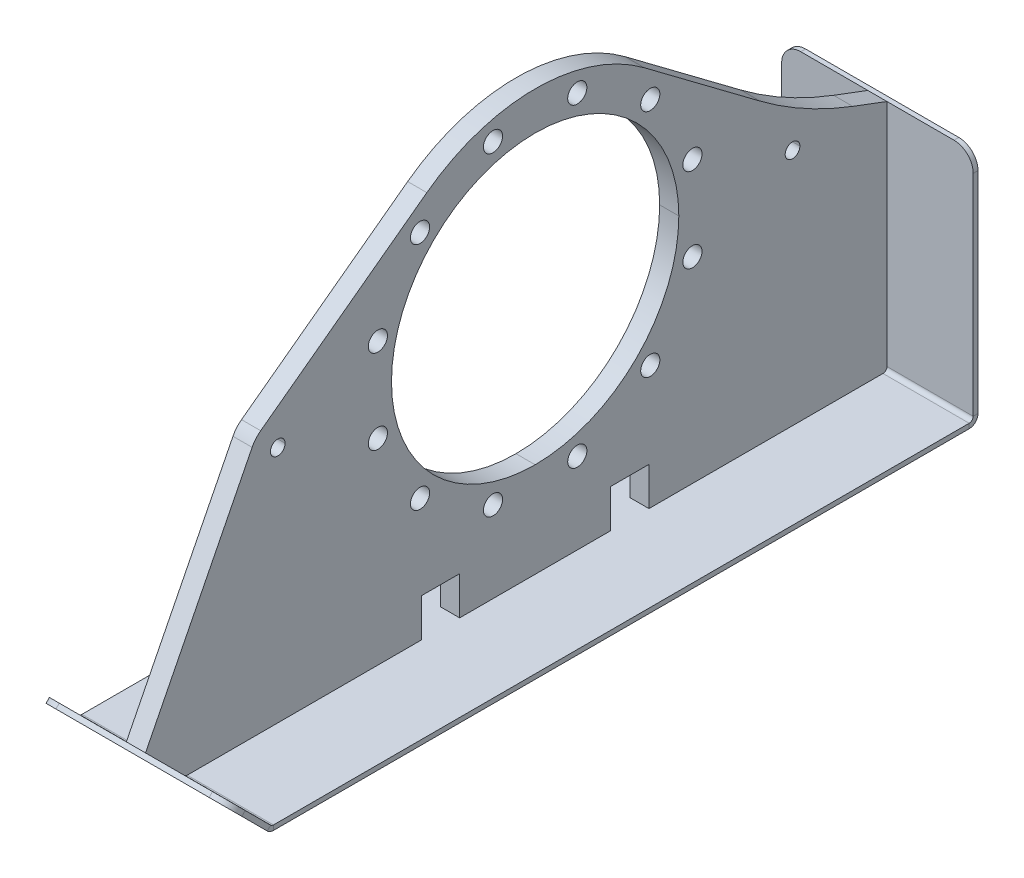
from build123d import *

# Parameters (mm, degrees)
FLANGE_PROFILE_DEPTH                = 12.7
F_7_8_1_DIAMETER_HOLE1_D            = 25.4
BOLT_PATTERN_COUNT                  = 12
SKETCH15_R                          = 9.72312
BOSS_EXTRUDE1_DEPTH                 = 12.7
SKETCH5_W                           = 254
SKETCH5_H                           = 1317.865260112
BASE_SKID_DEPTH                     = 6.35
BEND_START                          = -127
BEND_HEEL_DEPTH                     = 254
BEND_HEEL_2_DEPTH                   = 254
BEND_TOE_DEPTH                      = 254
BEND_TOE_2_DEPTH                    = 254
WEBBING_BODY_DEPTH                  = 12.7
WEBBING_EXTRUDE_DEPTH               = 12.7
SKID_START                          = -472.929130056
SKID_EDGES_DEPTH                    = 6.35
SKID_START_2                        = -334.061851681
SKID_EDGES_2_DEPTH                  = 6.35
FILLET1_R                           = 500
CONVERT_START                       = -12.7
CONVERT_FLANGE_TO_SHEET_OUTLINE_R   = 12.7
CONVERT_FLANGE_TO_SHEET_OUTLINE_R_2 = 9.72312
CONVERT_FLANGE_TO_SHEET_OUTLINE_R_3 = 190.5
CONVERT_FLANGE_TO_SHEET_DEPTH       = 25.4
CUT_EXTRUDE1_DEPTH                  = 774.747599071
CUT_EXTRUDE1_DEPTH_BACK             = 774.747599071
WEBBING_4_W                         = 50.8
WEBBING_4_H                         = 50.8


# Read off the part's stored shape, not the designer's step: Bend Heel, Bend Toe, Skid Edges, Convert Flange to Sheet
# Sheet-metal steps are written as plain solids
with BuildPart() as part:
    # Sketch1 → Flange Profile (new, symmetric)
    with BuildSketch(Plane(origin=(0, 0, 0), x_dir=(0, 0, -1), z_dir=(1, 0, 0))):
        with BuildLine():
            ThreePointArc((-190.5, 316.3), (0, 506.8), (190.5, 316.3))
            Line((190.5, 316.3), (241.3, 316.3))
            ThreePointArc((241.3, 316.3), (0, 557.6), (-241.3, 316.3))
            Line((-241.3, 316.3), (-190.5, 316.3))
        make_face()
        with BuildLine():
            Line((241.3, 316.3), (190.5, 316.3))
            ThreePointArc((190.5, 316.3), (0, 125.8), (-190.5, 316.3))
            Line((-190.5, 316.3), (-241.3, 316.3))
            ThreePointArc((-241.3, 316.3), (0, 75), (241.3, 316.3))
        make_face()
    extrude(amount=FLANGE_PROFILE_DEPTH, both=True)

    # 7/8 (1) Diameter Hole1 (through all)
    with Locations(Plane(origin=(12.7, 260.420968162, -208.543385896), x_dir=(0, 0, 1), z_dir=(1, 0, 0))):
        with Locations((0, 0)):
            f_7_8_1_diameter_hole1 = Hole(F_7_8_1_DIAMETER_HOLE1_D / 2)

    # Bolt Pattern: 7/8 (1) Diameter Hole1 ×12 about axis
    bolt_pattern_axis = Axis((0, 316.3, 0), (1, 0, 0))
    for i in range(1, BOLT_PATTERN_COUNT):
        add(f_7_8_1_diameter_hole1.rotate(bolt_pattern_axis, i * 360 / BOLT_PATTERN_COUNT), mode=Mode.SUBTRACT)

    # Sketch15 → Boss-Extrude1 (add, symmetric)
    with BuildSketch(Plane(origin=(0, 0, 0), x_dir=(0, 0, -1), z_dir=(1, 0, 0))):
        with BuildLine():
            Line((-238.273120599, 278.2), (-341.3, 278.2))
            ThreePointArc((-341.3, 278.2), (-379.4, 316.3), (-341.3, 354.4))
            Line((-341.3, 354.4), (-238.273120599, 354.4))
            ThreePointArc((-238.273120599, 354.4), (-200.173120599, 316.3), (-238.273120599, 278.2))
        make_face()
        with Locations((-341.3, 316.3)):
            Circle(SKETCH15_R, mode=Mode.SUBTRACT)
    boss_extrude1 = extrude(amount=BOSS_EXTRUDE1_DEPTH, both=True)

    # Mirror2: Boss-Extrude1 across plane
    add(boss_extrude1.mirror(Plane.XY))

    # Web Outline → Webbing Body (add, symmetric)
    with BuildSketch(Plane(origin=(0, 0, 0), x_dir=(0, 0, -1), z_dir=(1, 0, 0))):
        with BuildLine():
            Line((-516.69946035, 53.244915153), (-465.016837626, 1.562292429))
            ThreePointArc((-465.016837626, 1.562292429), (-463.286363484, 0.406026574), (-461.245130056, 0))
            Line((-461.245130056, 0), (461.245130056, 0))
            ThreePointArc((461.245130056, 0), (465.016837626, 1.562292429), (466.579130056, 5.334))
            Line((466.579130056, 5.334), (466.579130056, 309.66453199))
            Line((466.579130056, 309.66453199), (354.774573435, 351.937702939))
            ThreePointArc((354.774573435, 351.937702939), (378.779370872, 309.451149073), (341.3, 278.2))
            Line((341.3, 278.2), (238.273120599, 278.2))
            ThreePointArc((238.273120599, 278.2), (0, 75), (-238.273120599, 278.2))
            Line((-238.273120599, 278.2), (-341.3, 278.2))
            ThreePointArc((-341.3, 278.2), (-373.746134391, 296.328561317), (-375.315537192, 333.462553119))
            Line((-375.315537192, 333.462553119), (-516.69946035, 53.244915153))
        make_face()
    extrude(amount=WEBBING_BODY_DEPTH, both=True)

    # webbing → Webbing Extrude (add, symmetric)
    with BuildSketch(Plane(origin=(0, 0, 0), x_dir=(0, 0, -1), z_dir=(1, 0, 0))):
        with BuildLine():
            Line((-341.3, 354.4), (-238.273120599, 354.4))
            ThreePointArc((-238.273120599, 354.4), (-206.240337357, 441.562178038), (-143.662935834, 510.172769794))
            Line((-143.662935834, 510.172769794), (-363.983621447, 346.911489968))
            ThreePointArc((-363.983621447, 346.911489968), (-353.243873581, 352.479467711), (-341.3, 354.4))
        make_face()
        with BuildLine():
            ThreePointArc((144.724902657, 509.381310724), (206.583332152, 440.995697107), (238.273120599, 354.4))
            Line((238.273120599, 354.4), (341.3, 354.4))
            ThreePointArc((341.3, 354.4), (348.148850927, 353.779370872), (354.774573435, 351.937702939))
            Line((354.774573435, 351.937702939), (144.724902657, 509.381310724))
        make_face()
    extrude(amount=WEBBING_EXTRUDE_DEPTH, both=True)

    # Fillet1
    fillet1_edges = [part.edges().sort_by_distance(p)[0] for p in [
        (0, 351.937702939, -354.774573435),
    ]]
    fillet(fillet1_edges, radius=FILLET1_R)


with BuildPart() as body_2:
    # Sketch5 → Base Skid (new body)
    with BuildSketch(Plane(origin=(0, 0, 0), x_dir=(1, 0, 0), z_dir=(0, 1, 0))):
        with Locations((0, 118.6125)):
            Rectangle(SKETCH5_W, SKETCH5_H)
    extrude(amount=-BASE_SKID_DEPTH)

    # Bend Heel outline → Bend Heel (cut)
    with BuildSketch(Plane.YZ.offset(BEND_START)):
        with BuildLine():
            Line((0, -777.545130056), (0, -471.640528076))
            ThreePointArc((0, -471.640528076), (-4.636915504, -467.33583609), (-6.35, -461.245130056))
            Line((-6.35, -461.245130056), (-6.35, -777.545130056))
            Line((-6.35, -777.545130056), (0, -777.545130056))
        make_face()
    extrude(amount=BEND_HEEL_DEPTH, mode=Mode.SUBTRACT)

    # Bend Heel 2 outline → Bend Heel 2 (add)
    with BuildSketch(Plane.YZ.offset(BEND_START)):
        with BuildLine():
            Line((5.334, -472.929130056), (309.66453199, -472.929130056))
            Line((309.66453199, -472.929130056), (309.66453199, -466.579130056))
            Line((309.66453199, -466.579130056), (5.334, -466.579130056))
            ThreePointArc((5.334, -466.579130056), (1.56229243, -465.016837626), (0, -461.245130056))
            Line((0, -461.245130056), (0, -471.640528076))
            ThreePointArc((0, -471.640528076), (2.590277571, -472.602411563), (5.334, -472.929130056))
        make_face()
    extrude(amount=BEND_HEEL_2_DEPTH)

    # Bend Toe outline → Bend Toe (cut)
    with BuildSketch(Plane.YZ.offset(BEND_START)):
        with BuildLine():
            Line((-6.35, 540.320130056), (-6.35, 461.245130056))
            ThreePointArc((-6.35, 461.245130056), (-5.460608458, 465.71640328), (-2.927835631, 469.506965687))
            Line((-2.927835631, 469.506965687), (0, 472.434801318))
            Line((0, 472.434801318), (0, 540.320130056))
            Line((0, 540.320130056), (-6.35, 540.320130056))
        make_face()
    extrude(amount=BEND_TOE_DEPTH, mode=Mode.SUBTRACT)

    # Bend Toe 2 outline → Bend Toe 2 (add)
    with BuildSketch(Plane.YZ.offset(BEND_START)):
        with BuildLine():
            Line((48.754787092, 521.189588411), (0, 472.434801318))
            Line((0, 472.434801318), (0, 461.245130056))
            ThreePointArc((0, 461.245130056), (0.406026574, 463.286363484), (1.562292429, 465.016837626))
            Line((1.562292429, 465.016837626), (53.244915153, 516.69946035))
            Line((53.244915153, 516.69946035), (48.754787092, 521.189588411))
        make_face()
    extrude(amount=BEND_TOE_2_DEPTH)

    # Skid Edges outline → Skid Edges (cut)
    with BuildSketch(Plane.XY.offset(SKID_START)):
        with BuildLine():
            ThreePointArc((-127, 284.26453199), (-119.560512242, 302.225044232), (-101.6, 309.66453199))
            Line((-101.6, 309.66453199), (-127, 309.66453199))
            Line((-127, 309.66453199), (-127, 284.26453199))
        make_face()
        with BuildLine():
            ThreePointArc((101.6, 309.66453199), (119.560512242, 302.225044232), (127, 284.26453199))
            Line((127, 284.26453199), (127, 309.66453199))
            Line((127, 309.66453199), (101.6, 309.66453199))
        make_face()
    extrude(amount=SKID_EDGES_DEPTH, mode=Mode.SUBTRACT)

    # Skid Edges 2 outline → Skid Edges 2 (cut)
    with BuildSketch(Plane(origin=(0, 0, 0), x_dir=(1, 0, 0), z_dir=(0, 0.707106781186546, -0.707106781186549)).offset(SKID_START_2)):
        with BuildLine():
            Line((-127, -403.011532817), (-101.6, -403.011532817))
            ThreePointArc((-101.6, -403.011532817), (-119.560512242, -395.572045059), (-127, -377.611532817))
            Line((-127, -377.611532817), (-127, -403.011532817))
        make_face()
        with BuildLine():
            ThreePointArc((127, -377.611532817), (119.560512242, -395.572045059), (101.6, -403.011532817))
            Line((101.6, -403.011532817), (127, -403.011532817))
            Line((127, -403.011532817), (127, -377.611532817))
        make_face()
    extrude(amount=SKID_EDGES_2_DEPTH, mode=Mode.SUBTRACT)


with BuildPart() as body_3:
    # Convert Flange to Sheet outline → Convert Flange to Sheet (new body)
    with BuildSketch(Plane.YZ.offset(CONVERT_START)):
        with BuildLine():
            ThreePointArc((509.381310724, -144.724902657), (557.599091285, -0.66222749), (510.172769794, 143.662935834))
            Line((510.172769794, 143.662935834), (346.911489968, 363.983621447))
            ThreePointArc((346.911489968, 363.983621447), (340.849804008, 370.436182371), (333.462553119, 375.315537192))
            Line((333.462553119, 375.315537192), (53.244915153, 516.69946035))
            Line((53.244915153, 516.69946035), (1.562292429, 465.016837626))
            ThreePointArc((1.562292429, 465.016837626), (0.406026574, 463.286363484), (0, 461.245130056))
            Line((0, 461.245130056), (0, -461.245130056))
            ThreePointArc((0, -461.245130056), (1.56229243, -465.016837626), (5.334, -466.579130056))
            Line((5.334, -466.579130056), (309.66453199, -466.579130056))
            Line((309.66453199, -466.579130056), (326.862138017, -421.094708764))
            ThreePointArc((326.862138017, -421.094708764), (356.321830687, -357.183029185), (394.462927947, -298.040548863))
            Line((394.462927947, -298.040548863), (509.381310724, -144.724902657))
        make_face()
        with Locations((107.756614104, -55.879031838)):
            Circle(CONVERT_FLANGE_TO_SHEET_OUTLINE_R, mode=Mode.SUBTRACT)
        with Locations((163.635645942, -152.664354058)):
            Circle(CONVERT_FLANGE_TO_SHEET_OUTLINE_R, mode=Mode.SUBTRACT)
        with Locations((260.420968162, -208.543385896)):
            Circle(CONVERT_FLANGE_TO_SHEET_OUTLINE_R, mode=Mode.SUBTRACT)
        with Locations((316.3, -341.3)):
            Circle(CONVERT_FLANGE_TO_SHEET_OUTLINE_R_2, mode=Mode.SUBTRACT)
        with Locations((372.179031838, -208.543385896)):
            Circle(CONVERT_FLANGE_TO_SHEET_OUTLINE_R, mode=Mode.SUBTRACT)
        with Locations((316.3, 0)):
            Circle(CONVERT_FLANGE_TO_SHEET_OUTLINE_R_3, mode=Mode.SUBTRACT)
        with Locations((468.964354058, -152.664354058)):
            Circle(CONVERT_FLANGE_TO_SHEET_OUTLINE_R, mode=Mode.SUBTRACT)
        with Locations((524.843385896, -55.879031838)):
            Circle(CONVERT_FLANGE_TO_SHEET_OUTLINE_R, mode=Mode.SUBTRACT)
        with Locations((107.756614104, 55.879031838)):
            Circle(CONVERT_FLANGE_TO_SHEET_OUTLINE_R, mode=Mode.SUBTRACT)
        with Locations((163.635645942, 152.664354058)):
            Circle(CONVERT_FLANGE_TO_SHEET_OUTLINE_R, mode=Mode.SUBTRACT)
        with Locations((260.420968162, 208.543385896)):
            Circle(CONVERT_FLANGE_TO_SHEET_OUTLINE_R, mode=Mode.SUBTRACT)
        with Locations((372.179031838, 208.543385896)):
            Circle(CONVERT_FLANGE_TO_SHEET_OUTLINE_R, mode=Mode.SUBTRACT)
        with Locations((524.843385896, 55.879031838)):
            Circle(CONVERT_FLANGE_TO_SHEET_OUTLINE_R, mode=Mode.SUBTRACT)
        with Locations((468.964354058, 152.664354058)):
            Circle(CONVERT_FLANGE_TO_SHEET_OUTLINE_R, mode=Mode.SUBTRACT)
        with Locations((316.3, 341.3)):
            Circle(CONVERT_FLANGE_TO_SHEET_OUTLINE_R_2, mode=Mode.SUBTRACT)
    extrude(amount=CONVERT_FLANGE_TO_SHEET_DEPTH)

    # webbing<4> → Cut-Extrude1 (cut, two sides: drawn at the far end of the back side and taken through both)
    with BuildSketch(Plane(origin=(0, 0, 0), x_dir=(0, 0, -1), z_dir=(1, 0, 0)).offset(-CUT_EXTRUDE1_DEPTH_BACK)):
        with Locations((125.5, 25.4)):
            Rectangle(WEBBING_4_W, WEBBING_4_H)
        with Locations((-125.5, 25.4)):
            Rectangle(WEBBING_4_W, WEBBING_4_H)
    extrude(amount=CUT_EXTRUDE1_DEPTH + CUT_EXTRUDE1_DEPTH_BACK, mode=Mode.SUBTRACT)


solid = Compound([body_2.part, body_3.part])
